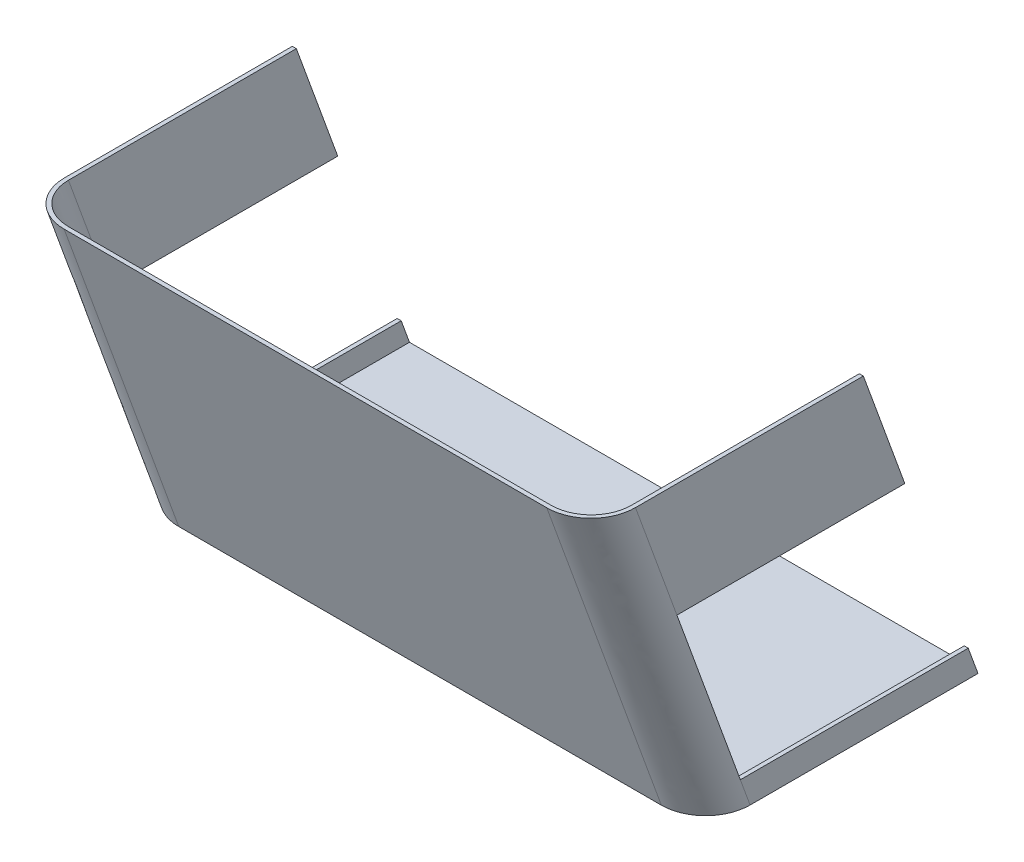
from build123d import *

# Parameters (mm, degrees)
SWEEP_THIN1_START       = 35.293924935
SWEEP_THIN1_DEPTH       = 179.41214993
SWEEP_THIN1_START_2     = -35.293925135
SWEEP_THIN1_2_DEPTH     = 320.58785027
SWEEP_THIN1_START_3     = -67
SWEEP_THIN1_3_OUTLINE_W = 426
SWEEP_THIN1_3_OUTLINE_H = 295
SWEEP_THIN1_3_DEPTH     = 67
SWEEP_THIN1_START_4     = 234.923155196
SWEEP_THIN1_4_OUTLINE_W = 426
SWEEP_THIN1_4_OUTLINE_H = 295
SWEEP_THIN1_4_DEPTH     = 66.330881923
BOSS_EXTRUDE2_DEPTH     = 3
SKETCH6_W               = 723.00386444
SKETCH6_H               = 605.053805232
CUT_EXTRUDE1_DEPTH      = 3
CUT_EXTRUDE2_DEPTH      = 522.796571163


with BuildPart() as part:
    # Sweep-Thin1: read off the stored shape, not the designer's step
    # Sweep-Thin1 outline → Sweep-Thin1 (new body)
    with BuildSketch(Plane(origin=(0, 0, 0), x_dir=(1, 0, 0), z_dir=(0, 0.9396926207859089, 0.3420201433256673)).offset(SWEEP_THIN1_START)):
        with BuildLine():
            Line((213, -65.778483455), (213, 96.969262079))
            Line((213, 96.969262079), (-213, 96.969262079))
            Line((-213, 96.969262079), (-213, -65.778483455))
            add(Edge.make_bspline(
                [(-213, -65.778483455), (-213, -69.477042237), (-212.493972968, -73.37256542), (-211.393047263, -77.378729206), (-209.625765414, -81.371277703), (-207.160966169, -85.187590547), (-204.030117008, -88.644891062), (-200.35485162, -91.564481232), (-196.328004584, -93.851338413), (-192.135894004, -95.485342048), (-187.941508955, -96.501990369), (-183.867765418, -96.969262079), (-180, -96.969262079)],
                knots=[0, 0, 0, 0, 0, 0, 0, 0, 0, 0, 0, 0, 0, 1, 1, 1, 1, 1, 1, 1, 1, 1, 1, 1, 1, 1], degree=12))
            Line((-180, -96.969262079), (180, -96.969262079))
            add(Edge.make_bspline(
                [(180, -96.969262079), (183.867765418, -96.969262079), (187.941508955, -96.501990369), (192.135894005, -95.485342048), (196.328004584, -93.851338413), (200.35485162, -91.564481232), (204.030117008, -88.644891062), (207.16096617, -85.187590547), (209.625765413, -81.371277703), (211.393047263, -77.378729206), (212.493972968, -73.37256542), (213, -69.477042237), (213, -65.778483455)],
                knots=[0, 0, 0, 0, 0, 0, 0, 0, 0, 0, 0, 0, 0, 1, 1, 1, 1, 1, 1, 1, 1, 1, 1, 1, 1, 1], degree=12))
        make_face()
        with BuildLine():
            Line((-210, 93.969262079), (210, 93.969262079))
            Line((210, 93.969262079), (210, -65.778483455))
            add(Edge.make_bspline(
                [(180, -93.969262079), (197.573593129, -93.969262079), (210, -82.292259239), (210, -65.778483455)],
                knots=[0, 0, 0, 0, 1, 1, 1, 1], degree=3, weights=[1, 0.804737854, 0.804737854, 1]))
            Line((180, -93.969262079), (-180, -93.969262079))
            add(Edge.make_bspline(
                [(-210, -65.778483455), (-210, -82.292259239), (-197.573593129, -93.969262079), (-180, -93.969262079)],
                knots=[0, 0, 0, 0, 1, 1, 1, 1], degree=3, weights=[1, 0.804737854, 0.804737854, 1]))
            Line((-210, -65.778483455), (-210, 93.969262079))
        make_face(mode=Mode.SUBTRACT)
    extrude(amount=SWEEP_THIN1_DEPTH)

    # Sweep-Thin1 2 outline → Sweep-Thin1 2 (add)
    with BuildSketch(Plane(origin=(0, 0, 0), x_dir=(1, 0, 0), z_dir=(0, 0.9396926207859089, 0.3420201433256673)).offset(SWEEP_THIN1_START_2)):
        with BuildLine():
            Line((-213, 96.969262079), (-213, -65.778483455))
            add(Edge.make_bspline(
                [(-213, -65.778483455), (-213, -69.477042237), (-212.493972968, -73.37256542), (-211.393047263, -77.378729206), (-209.625765414, -81.371277703), (-207.160966169, -85.187590547), (-204.030117008, -88.644891062), (-200.35485162, -91.564481232), (-196.328004584, -93.851338413), (-192.135894004, -95.485342048), (-187.941508955, -96.501990369), (-183.867765418, -96.969262079), (-180, -96.969262079)],
                knots=[0, 0, 0, 0, 0, 0, 0, 0, 0, 0, 0, 0, 0, 1, 1, 1, 1, 1, 1, 1, 1, 1, 1, 1, 1, 1], degree=12))
            Line((-180, -96.969262079), (180, -96.969262079))
            add(Edge.make_bspline(
                [(180, -96.969262079), (183.867765418, -96.969262079), (187.941508955, -96.501990369), (192.135894005, -95.485342048), (196.328004584, -93.851338413), (200.35485162, -91.564481232), (204.030117008, -88.644891062), (207.16096617, -85.187590547), (209.625765413, -81.371277703), (211.393047263, -77.378729206), (212.493972968, -73.37256542), (213, -69.477042237), (213, -65.778483455)],
                knots=[0, 0, 0, 0, 0, 0, 0, 0, 0, 0, 0, 0, 0, 1, 1, 1, 1, 1, 1, 1, 1, 1, 1, 1, 1, 1], degree=12))
            Line((213, -65.778483455), (213, 96.969262079))
            Line((213, 96.969262079), (-213, 96.969262079))
        make_face()
        with BuildLine():
            add(Edge.make_bspline(
                [(-210, -65.778483455), (-210, -82.292259239), (-197.573593129, -93.969262079), (-180, -93.969262079)],
                knots=[0, 0, 0, 0, 1, 1, 1, 1], degree=3, weights=[1, 0.804737854, 0.804737854, 1]))
            Line((-210, -65.778483455), (-210, 93.969262079))
            Line((-210, 93.969262079), (210, 93.969262079))
            Line((210, 93.969262079), (210, -65.778483455))
            add(Edge.make_bspline(
                [(180, -93.969262079), (197.573593129, -93.969262079), (210, -82.292259239), (210, -65.778483455)],
                knots=[0, 0, 0, 0, 1, 1, 1, 1], degree=3, weights=[1, 0.804737854, 0.804737854, 1]))
            Line((180, -93.969262079), (-180, -93.969262079))
        make_face(mode=Mode.SUBTRACT)
    extrude(amount=SWEEP_THIN1_2_DEPTH)

    # Sweep-Thin1 3 outline → Sweep-Thin1 3 (cut)
    with BuildSketch(Plane(origin=(0, 0, 0), x_dir=(1, 0, 0), z_dir=(0, 1, 0)).offset(SWEEP_THIN1_START_3)):
        with Locations((0, -42.5)):
            Rectangle(SWEEP_THIN1_3_OUTLINE_W, SWEEP_THIN1_3_OUTLINE_H)
    extrude(amount=SWEEP_THIN1_3_DEPTH, mode=Mode.SUBTRACT)

    # Sweep-Thin1 4 outline → Sweep-Thin1 4 (cut)
    with BuildSketch(Plane(origin=(0, 0, 0), x_dir=(1, 0, 0), z_dir=(0, 1, 0)).offset(SWEEP_THIN1_START_4)):
        with Locations((0, -42.5)):
            Rectangle(SWEEP_THIN1_4_OUTLINE_W, SWEEP_THIN1_4_OUTLINE_H)
    extrude(amount=SWEEP_THIN1_4_DEPTH, mode=Mode.SUBTRACT)


with BuildPart() as body_2:
    # Sketch5 → Boss-Extrude2 (new body)
    with BuildSketch(Plane(origin=(0, 0, 0), x_dir=(1, 0, 0), z_dir=(0, 1, 0))):
        with BuildLine():
            Line((-180, -100), (180, -100))
            ThreePointArc((180, -100), (201.213203436, -91.213203436), (210, -70))
            Line((210, -70), (210, 100))
            Line((210, 100), (-210, 100))
            Line((-210, 100), (-210, -70))
            ThreePointArc((-210, -70), (-201.213203436, -91.213203436), (-180, -100))
        make_face()
    extrude(amount=BOSS_EXTRUDE2_DEPTH)


with BuildPart() as cut_extrude1_tool:
    # Sketch6 → Cut-Extrude1 (new body)
    with BuildSketch(Plane(origin=(0, 33.165440914, -91.121300018), x_dir=(-1, 0, 0), z_dir=(0, 0.34202014332566627, -0.9396926207859093))):
        Rectangle(SKETCH6_W, SKETCH6_H)
    extrude(amount=-CUT_EXTRUDE1_DEPTH)


with BuildPart() as part_1:
    add(part.part)

    # Cut-Extrude1: cut by cut_extrude1_tool
    add(cut_extrude1_tool.part, mode=Mode.SUBTRACT)

    # Sketch7 → Cut-Extrude2 (cut, through all)
    with BuildSketch(Plane.ZY.offset(213)):
        Polygon((-45.40446486, 150), (124.59553514, 150), (77.279404685, 20), (-92.720595315, 20), align=None)
    extrude(amount=-CUT_EXTRUDE2_DEPTH, mode=Mode.SUBTRACT)


with BuildPart() as body_2_1:
    add(body_2.part)

    # Cut-Extrude1: cut by cut_extrude1_tool
    add(cut_extrude1_tool.part, mode=Mode.SUBTRACT)


solid = Compound([part_1.part, body_2_1.part])
